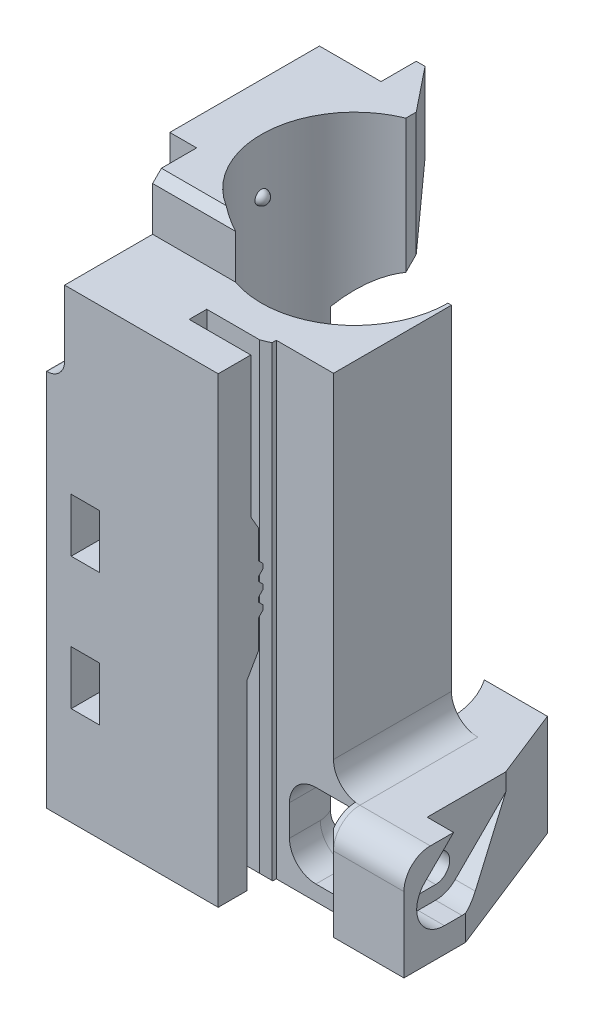
from build123d import *

# Parameters (mm, degrees)
BOSS_EXTRUDE1_DEPTH      = 37
BOSS_EXTRUDE1_DEPTH_BACK = 22
CUT_EXTRUDE5_DEPTH       = 7
CHAMFER3_SIZE            = 0.5
SKETCH6_R                = 1.65
CUT_EXTRUDE6_DEPTH       = 10
CUT_EXTRUDE7_START       = -2.8
CUT_EXTRUDE7_DEPTH       = 3.2
CUT_EXTRUDE9_DEPTH       = 10
CUT_EXTRUDE9_DEPTH_BACK  = 12
BOSS_EXTRUDE2_DEPTH      = 1
SKETCH10_W               = 7
SKETCH10_H               = 8.2
CUT_EXTRUDE10_DEPTH      = 4
SKETCH11_R               = 1.25
CUT_EXTRUDE11_DEPTH      = 4
CHAMFER4_SIZE            = 3
CUT_EXTRUDE12_DEPTH      = 6
CHAMFER5_SIZE            = 1
CUT_EXTRUDE14_START      = 12
CUT_EXTRUDE14_DEPTH      = 57.552242852
CHAMFER6_SIZE            = 1
CHAMFER7_SIZE            = 0.4
CHAMFER7_SIZE2           = 1
CHAMFER10_SIZE           = 0.4
CHAMFER10_SIZE2          = 2
CUT_EXTRUDE18_DEPTH      = 15
CHAMFER15_SIZE           = 4
CHAMFER15_SIZE2          = 5
FILLET3_R                = 3
CUT_EXTRUDE19_DEPTH      = 2.5
CUT_EXTRUDE19_DEPTH_BACK = 5
CUT_EXTRUDE20_REACH      = 58.683
CUT_EXTRUDE21_DEPTH      = 3
SKETCH25_W               = 2.5
SKETCH25_H               = 3.75
CUT_EXTRUDE23_DEPTH      = 3
FILLET4_START            = 13.950475362
FILLET4_DEPTH            = 9.049524638
CHAMFER18_SIZE           = 0.5
FILLET5_R                = 1
FILLET6_R                = 3


with BuildPart() as part:
    # Sketch2 → Boss-Extrude1 (new, two sides: drawn at the far end of the back side and taken through both)
    with BuildSketch(Plane(origin=(0, 0, 0), x_dir=(1, 0, 0), z_dir=(0, 1, 0)).offset(-BOSS_EXTRUDE1_DEPTH_BACK)):
        with BuildLine():
            Line((22, -16.4), (22, -9.4))
            Line((22, -9.4), (15.905973721, 6))
            Line((15.905973721, 6), (8.73842091, 6))
            ThreePointArc((8.73842091, 6), (-3.042074838, -10.154101668), (-4, 9.816312953))
            Line((-4, 9.816312953), (-4, 16))
            Line((-4, 16), (-15, 16))
            Line((-15, 16), (-15, -20))
            Line((-15, -20), (4.5, -20))
            Line((4.5, -20), (4.5, -13.4))
            Line((4.5, -13.4), (11, -13.4))
            Line((11, -13.4), (14, -16.4))
            Line((14, -16.4), (22, -16.4))
        make_face()
    extrude(amount=BOSS_EXTRUDE1_DEPTH + BOSS_EXTRUDE1_DEPTH_BACK)

    # Sketch5 → Cut-Extrude5 (cut)
    with BuildSketch(Plane(origin=(4.5, 0, 0), x_dir=(0, 0, -1), z_dir=(1, 0, 0))):
        Polygon((-15.4, 4.718), (-14.9, 5.218), (-14.9, 5.718), (-15.4, 6.218), (-15.4, 6.75), (-14.9, 7.25), (-14.9, 7.75), (-15.4, 8.25), (-15.4, 8.782), (-14.9, 9.282), (-14.9, 9.782), (-15.4, 10.282), (-15.4, 13.5), (-16.3, 15.058845727), (-16.3, 37), (-14.3, 37), (-14.3, -22), (-16.3, -22), (-16.3, -0.058845727), (-15.4, 1.5), align=None)
    extrude(amount=-CUT_EXTRUDE5_DEPTH, mode=Mode.SUBTRACT)

    # Chamfer3
    chamfer3_edges = [part.edges().sort_by_distance(p)[0] for p in [
        (-5.25, -22, 20),
        (-15, -22, 2),
        (4.5, -22, 18.15),
        (-9.5, -22, -16),
        (-4, -22, -12.908156477),
        (-3.042074838, -22, 10.154101668),
        (1, -22, 14.3),
        (-2.5, -22, 15.3),
        (1, -22, 16.3),
    ]]
    chamfer(chamfer3_edges, length=CHAMFER3_SIZE)

    # Sketch6 → Cut-Extrude6 (cut)
    with BuildSketch(Plane.ZY.offset(15)):
        with Locations((13, 7.5)):
            Circle(SKETCH6_R)
        with Locations((13, -7.5)):
            Circle(SKETCH6_R)
    extrude(amount=-CUT_EXTRUDE6_DEPTH, mode=Mode.SUBTRACT)

    # Sketch7 → Cut-Extrude7 (cut)
    with BuildSketch(Plane.ZY.offset(15).offset(CUT_EXTRUDE7_START)):
        Polygon((21.314139376, -4.2), (21.314139376, -10.3), (10.983419246, -10.3), (9.366838493, -7.5), (11.272094381, -4.2), align=None)
        Polygon((11.383419246, 4.7), (9.766838493, 7.5), (11.672094381, 10.8), (21.314139376, 10.8), (21.314139376, 4.7), align=None)
    extrude(amount=-CUT_EXTRUDE7_DEPTH, mode=Mode.SUBTRACT)

    # Sketch9 → Cut-Extrude9 (cut, two sides: drawn at the far end of the back side and taken through both)
    with BuildSketch(Plane.ZY.offset(15).offset(-CUT_EXTRUDE9_DEPTH_BACK)):
        Polygon((-16, 28), (-6, 18), (-6, -22), (-16, -22), align=None)
    extrude(amount=CUT_EXTRUDE9_DEPTH + CUT_EXTRUDE9_DEPTH_BACK, mode=Mode.SUBTRACT)

    # Sketch12 → Boss-Extrude2 (add)
    with BuildSketch(Plane.ZY.offset(15)):
        Polygon((8, 37), (8, 30), (5, 30), (5, 25), (-13, 25), (-16, 28), (-16, 37), align=None)
    extrude(amount=BOSS_EXTRUDE2_DEPTH)

    # Sketch10 → Cut-Extrude10 (cut)
    with BuildSketch(Plane(origin=(0, 0, -16), x_dir=(-1, 0, 0), z_dir=(0, 0, -1))):
        with Locations((12.5, 32.9)):
            Rectangle(SKETCH10_W, SKETCH10_H)
    extrude(amount=-CUT_EXTRUDE10_DEPTH, mode=Mode.SUBTRACT)

    # Sketch11 → Cut-Extrude11 (cut)
    with BuildSketch(Plane.ZY.offset(16)):
        with Locations((-9, 26.3)):
            Circle(SKETCH11_R)
        with Locations((1, 26.3)):
            Circle(SKETCH11_R)
    extrude(amount=-CUT_EXTRUDE11_DEPTH, mode=Mode.SUBTRACT)

    # Chamfer4
    # the kernel refuses this chamfer: 3 mm, written as the material it adds along each edge
    with BuildSketch(Plane(origin=(-15, 37, 8), x_dir=(0, 0, 1), z_dir=(0, -1, 0))) as chamfer4_piece_1_section:
        Polygon((CHAMFER4_SIZE, 0), (0, CHAMFER4_SIZE), (0, 0), align=None)
    chamfer4_piece_1 = extrude(amount=7, mode=Mode.PRIVATE)
    chamfer4_piece_1 = split(chamfer4_piece_1, bisect_by=Plane(origin=(-16, 37, 8), z_dir=(1, 0, 0)), keep=Keep.TOP, mode=Mode.PRIVATE)
    add(chamfer4_piece_1)
    with BuildSketch(Plane(origin=(-15, 25, 5), x_dir=(0, -1, 0), z_dir=(0, 0, -1))) as chamfer4_piece_2_section:
        Polygon((CHAMFER4_SIZE, 0), (0, CHAMFER4_SIZE), (0, 0), align=None)
    chamfer4_piece_2 = extrude(amount=25.715048964, mode=Mode.PRIVATE)
    chamfer4_piece_2 = split(chamfer4_piece_2, bisect_by=Plane(origin=(-15, 16, -4), z_dir=(0, 0.7071067811865439, 0.7071067811865511)), keep=Keep.TOP, mode=Mode.PRIVATE)
    chamfer4_piece_2 = split(chamfer4_piece_2, bisect_by=Plane(origin=(-16, 25, 5), z_dir=(1, 0, 0)), keep=Keep.TOP, mode=Mode.PRIVATE)
    add(chamfer4_piece_2)

    # Sketch13 → Cut-Extrude12 (cut)
    with BuildSketch(Plane(origin=(0, 37, 0), x_dir=(1, 0, 0), z_dir=(0, 1, 0))):
        Polygon((-16, -10), (0, -10), (0, 6.411173943), (12, 6.411173943), (12, -20), (-16, -20), align=None)
    extrude(amount=-CUT_EXTRUDE12_DEPTH, mode=Mode.SUBTRACT)

    # Chamfer5
    chamfer5_edges = [part.edges().sort_by_distance(p)[0] for p in [
        (-9.757839583, 37, 10),
    ]]
    chamfer(chamfer5_edges, length=CHAMFER5_SIZE)

    # Sketch15 → Cut-Extrude14 (cut, through all)
    with BuildSketch(Plane(origin=(0, -22, -7.1), x_dir=(1, 0, 0), z_dir=(0, 1, 0)).offset(CUT_EXTRUDE14_START)):
        Polygon((22, -23.5), (11, -23.5), (11, -7.1), (8.19328567, -7.1), (8.19328567, -1.1), (22, -1.1), align=None)
    extrude(amount=CUT_EXTRUDE14_DEPTH, mode=Mode.SUBTRACT)

    # Chamfer6
    chamfer6_edges = [part.edges().sort_by_distance(p)[0] for p in [
        (-15, -1.75, -6),
    ]]
    chamfer(chamfer6_edges, length=CHAMFER6_SIZE)

    # Chamfer7
    chamfer7_edges = [part.edges().sort_by_distance(p)[0] for p in [
        (4.5, 4.75, 14.3),
    ]]
    chamfer7_side = [part.faces().sort_by_distance(p)[0] for p in [
        (4.5, 4.569189, 13.849255561),
    ]]
    chamfer(chamfer7_edges, length=CHAMFER7_SIZE, length2=CHAMFER7_SIZE2, reference=chamfer7_side[0])

    # Chamfer10
    chamfer10_edges = [part.edges().sort_by_distance(p)[0] for p in [
        (4.5, -10.779422863, 16.3),
    ]]
    chamfer10_side = [part.faces().sort_by_distance(p)[0] for p in [
        (4.5, 4.931209938, 17.994705907),
    ]]
    chamfer(chamfer10_edges, length=CHAMFER10_SIZE, length2=CHAMFER10_SIZE2, reference=chamfer10_side[0])

    # Sketch19 → Cut-Extrude18 (cut)
    with BuildSketch(Plane.XY.offset(20)):
        with BuildLine():
            Line((-16, 37), (-12.95, 37))
            Line((-12.95, 37), (-12.95, 23.500079395))
            ThreePointArc((-12.95, 23.500079395), (-13.535786438, 22.085865833), (-14.95, 21.500079395))
            Line((-14.95, 21.500079395), (-16, 21.500079395))
            Line((-16, 21.500079395), (-16, 37))
        make_face()
    extrude(amount=-CUT_EXTRUDE18_DEPTH, mode=Mode.SUBTRACT)

    # Chamfer15
    chamfer15_edges = [part.edges().sort_by_distance(p)[0] for p in [
        (-4, 32.5, -16),
    ]]
    chamfer15_side = [part.faces().sort_by_distance(p)[0] for p in [
        (-7.164031621, 32.046245059, -16),
    ]]
    chamfer(chamfer15_edges, length=CHAMFER15_SIZE, length2=CHAMFER15_SIZE2, reference=chamfer15_side[0])

    # Sketch20 → Revolve2 (revolve)
    with BuildSketch(Plane.XY):
        with BuildLine():
            Line((-10.6, 30.1), (-10.6, 31.6))
            ThreePointArc((-10.6, 31.6), (-11.35, 30.85), (-10.6, 30.1))
        make_face()
        with BuildLine():
            Line((-10.6, -13.1), (-10.6, -14.6))
            ThreePointArc((-10.6, -14.6), (-11.35, -13.85), (-10.6, -13.1))
        make_face()
    revolve(axis=Axis((-10.6, 30.85, 0), (0, -1, 0)))

    # Fillet3
    fillet3_edges = [part.edges().sort_by_distance(p)[0] for p in [
        (11, -10, 6.7),
    ]]
    fillet(fillet3_edges, radius=FILLET3_R)

    # Sketch21 → Cut-Extrude19 (cut, two sides: drawn at the far end of the back side and taken through both)
    with BuildSketch(Plane(origin=(11, 0, 0), x_dir=(0, 0, -1), z_dir=(1, 0, 0)).offset(-CUT_EXTRUDE19_DEPTH_BACK)):
        with BuildLine():
            Line((-9.9, -10.75), (-20, -10.75))
            Line((-20, -10.75), (-20, -20.25))
            Line((-20, -20.25), (-9.9, -20.25))
            ThreePointArc((-9.9, -20.25), (-5.15, -15.5), (-9.9, -10.75))
        make_face()
    extrude(amount=CUT_EXTRUDE19_DEPTH + CUT_EXTRUDE19_DEPTH_BACK, mode=Mode.SUBTRACT)

    # Sketch22 → Cut-Extrude20 (cut, up to next)
    with BuildSketch(Plane(origin=(22, 0, 0), x_dir=(0, 0, -1), z_dir=(1, 0, 0)), mode=Mode.PRIVATE) as cut_extrude20_sk1:
        with BuildLine():
            Line((-9.8, -17.1), (-11.8, -17.1))
            ThreePointArc((-11.8, -17.1), (-13.4, -15.5), (-11.8, -13.9))
            Line((-11.8, -13.9), (-9.8, -13.9))
            ThreePointArc((-9.8, -13.9), (-8.2, -15.5), (-9.8, -17.1))
        make_face()
    cut_extrude20_tool1 = extrude(cut_extrude20_sk1.sketch, amount=-CUT_EXTRUDE20_REACH, mode=Mode.PRIVATE) & part.part
    add(cut_extrude20_tool1.solids().sort_by_distance((22, -15.5, 10.8))[0], mode=Mode.SUBTRACT)

    # Sketch23 → Cut-Extrude21 (cut)
    with BuildSketch(Plane(origin=(22, 0, 0), x_dir=(0, 0, -1), z_dir=(1, 0, 0))):
        with BuildLine():
            Line((-9.8, -18.65), (-11.8, -18.65))
            ThreePointArc((-11.8, -18.65), (-14.710220527, -16.705452812), (-14.027386361, -13.272613639))
            Line((-14.027386361, -13.272613639), (-10.754772721, -10))
            Line((-10.754772721, -10), (0.154772721, -10))
            Line((0.154772721, -10), (-7.572613639, -17.727386361))
            ThreePointArc((-7.572613639, -17.727386361), (-8.594547188, -18.410220527), (-9.8, -18.65))
        make_face()
    extrude(amount=-CUT_EXTRUDE21_DEPTH, mode=Mode.SUBTRACT)

    # Sketch25 → Cut-Extrude23 (cut)
    with BuildSketch(Plane.XY.offset(16.4)):
        with Locations((12.25, -8.875)):
            Rectangle(SKETCH25_W, SKETCH25_H)
    extrude(amount=-CUT_EXTRUDE23_DEPTH, mode=Mode.SUBTRACT)

    # Fillet4: read off the stored shape, not the designer's step
    # Fillet4 outline → Fillet4 (cut)
    with BuildSketch(Plane.YZ.offset(FILLET4_START)):
        with BuildLine():
            ThreePointArc((-13, 16.4), (-10.878679656, 15.521320344), (-10, 13.4))
            Line((-10, 13.4), (-10, 16.4))
            Line((-10, 16.4), (-13, 16.4))
        make_face()
    extrude(amount=FILLET4_DEPTH, mode=Mode.SUBTRACT)

    # Fillet4 2 outline → Fillet4 2 (revolve, cut)
    with BuildSketch(Plane(origin=(14, -7, 0), x_dir=(1, 0, 0), z_dir=(0, -1, 0))):
        with BuildLine():
            ThreePointArc((3, 13.4), (3.878679656, 15.521320344), (6, 16.4))
            Line((6, 16.4), (3, 16.4))
            Line((3, 16.4), (3, 13.4))
        make_face()
    revolve(axis=Axis((14, -7, 0), (0, 0, 1)), mode=Mode.SUBTRACT)

    # Chamfer18
    chamfer18_edges = [part.edges().sort_by_distance(p)[0] for p in [
        (18, -22, 16.4),
        (22, -22, 12.9),
        (18.95298686, -22, 1.7),
    ]]
    chamfer(chamfer18_edges, length=CHAMFER18_SIZE)

    # Fillet5
    fillet5_edges = [part.edges().sort_by_distance(p)[0] for p in [
        (13.5, -20.25, 12.9),
        (13.5, -15.5, 5.15),
        (13.5, -10.75, 11.65),
    ]]
    fillet(fillet5_edges, radius=FILLET5_R)

    # Fillet6
    fillet6_edges = [part.edges().sort_by_distance(p)[0] for p in [
        (6, -20.213807786, 9.314751202),
        (6, -10.786192214, 9.314751202),
        (6, -20.25, 11.65),
        (6, -10.75, 11.65),
    ]]
    fillet(fillet6_edges, radius=FILLET6_R)


solid = part.part
